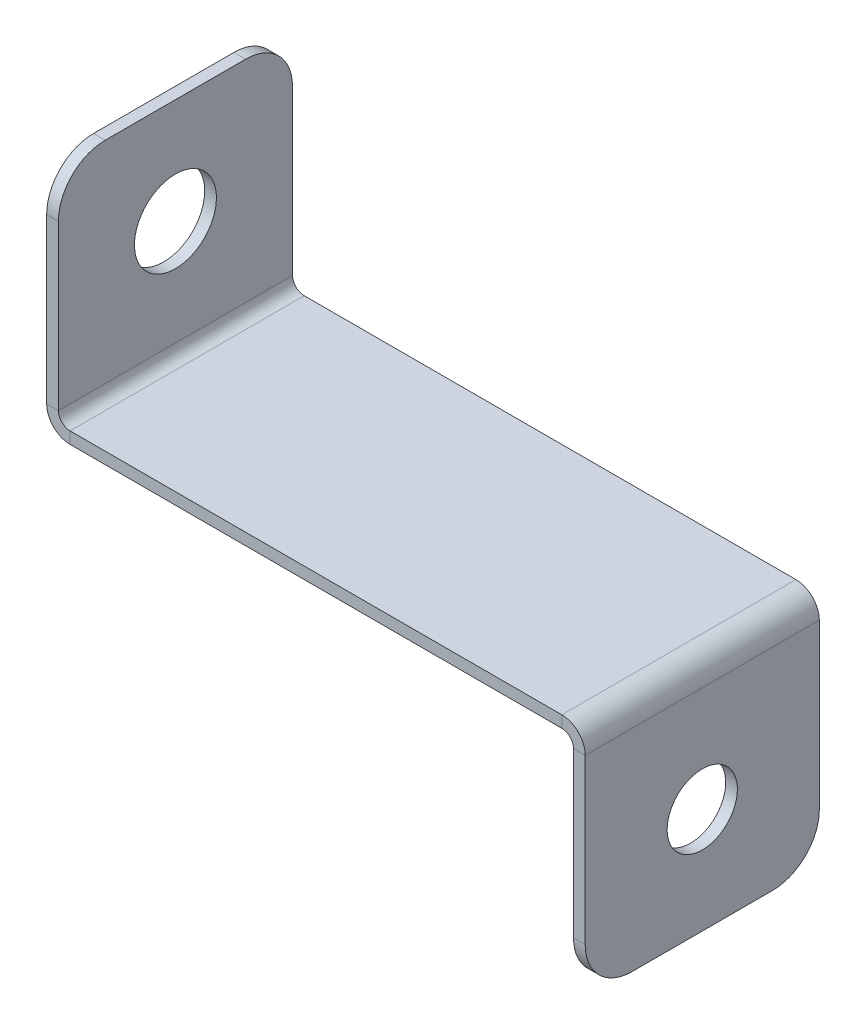
from build123d import *

# Parameters (mm, degrees)
SKETCH_1_W                       = 23
SKETCH_1_H                       = 10
EXTRUDE_1_DEPTH                  = 0.5
SM_EDGE_FLANGE_1_STRIP_W         = 3
SM_EDGE_FLANGE_1_STRIP_H         = 0.5
SM_EDGE_FLANGE_1_STRIP_CUT_DEPTH = 10
SM_EDGE_FLANGE_1_DEPTH           = 10
SM_EDGE_FLANGE_2_STRIP_W         = 3
SM_EDGE_FLANGE_2_STRIP_H         = 0.5
SM_EDGE_FLANGE_2_STRIP_CUT_DEPTH = 10
SM_EDGE_FLANGE_2_DEPTH           = 10
SKETCH_12_R                      = 1.5
CUT_EXTRUDE_1_DEPTH              = 0.5
SKETCH_13_R                      = 1.75
CUT_EXTRUDE_2_DEPTH              = 0.5
FILLET_1_R                       = 2


# Sheet-metal steps are written as plain solids
with BuildPart() as part:
    # Sketch 1 → Бобышка-Вытянуть1 (new body)
    with BuildSketch(Plane(origin=(0, 0, 0), x_dir=(1, 0, 0), z_dir=(0, 1, 0))):
        with Locations((-10.5, 0)):
            Rectangle(SKETCH_1_W, SKETCH_1_H)
    extrude(amount=EXTRUDE_1_DEPTH)

    # Ребро-кромка1 strip (across the edge) → Ребро-кромка1 strip cut (cut)
    with BuildSketch(Plane(origin=(1, 0, -5), x_dir=(-1, 0, 0), z_dir=(0, 0, 1))):
        with Locations((-0.5, -0.25)):
            Rectangle(SM_EDGE_FLANGE_1_STRIP_W, SM_EDGE_FLANGE_1_STRIP_H)
    extrude(amount=SM_EDGE_FLANGE_1_STRIP_CUT_DEPTH, mode=Mode.SUBTRACT)

    # Ребро-кромка1 section (across the edge) → Ребро-кромка1 (add)
    with BuildSketch(Plane(origin=(1, 0, -5), x_dir=(-1, 0, 0), z_dir=(0, 0, 1))):
        with BuildLine():
            Line((0, 0.5), (0, 9.5))
            Line((0, 9.5), (0.5, 9.5))
            Line((0.5, 9.5), (0.5, 0.5))
            ThreePointArc((0.5, 0.5), (0.646446609, 0.146446609), (1, 0))
            Line((1, 0), (1, -0.5))
            ThreePointArc((1, -0.5), (0.292893219, -0.207106781), (0, 0.5))
        make_face()
    extrude(amount=SM_EDGE_FLANGE_1_DEPTH)

    # Ребро-кромка2 strip (across the edge) → Ребро-кромка2 strip cut (cut)
    with BuildSketch(Plane(origin=(-22, 0.5, -5), x_dir=(1, 0, 0), z_dir=(0, 0, 1))):
        with Locations((-0.5, -0.25)):
            Rectangle(SM_EDGE_FLANGE_2_STRIP_W, SM_EDGE_FLANGE_2_STRIP_H)
    extrude(amount=SM_EDGE_FLANGE_2_STRIP_CUT_DEPTH, mode=Mode.SUBTRACT)

    # Ребро-кромка2 section (across the edge) → Ребро-кромка2 (add)
    with BuildSketch(Plane(origin=(-22, 0.5, -5), x_dir=(1, 0, 0), z_dir=(0, 0, 1))):
        with BuildLine():
            Line((0, 0.5), (0, 9.5))
            Line((0, 9.5), (0.5, 9.5))
            Line((0.5, 9.5), (0.5, 0.5))
            ThreePointArc((0.5, 0.5), (0.646446609, 0.146446609), (1, 0))
            Line((1, 0), (1, -0.5))
            ThreePointArc((1, -0.5), (0.292893219, -0.207106781), (0, 0.5))
        make_face()
    extrude(amount=SM_EDGE_FLANGE_2_DEPTH)

    # Эскиз12 → Вырез-Вытянуть1 (cut)
    with BuildSketch(Plane(origin=(1, 0, 0), x_dir=(0, 0, -1), z_dir=(1, 0, 0))):
        with Locations(Location((0, -5, 0), (0, 0, 90))):
            Circle(SKETCH_12_R)
    extrude(amount=-CUT_EXTRUDE_1_DEPTH, mode=Mode.SUBTRACT)

    # Эскиз13 → Вырез-Вытянуть2 (cut)
    with BuildSketch(Plane(origin=(-21.5, 0, 0), x_dir=(0, 0, -1), z_dir=(1, 0, 0))):
        with Locations(Location((0, 5.5, 0), (0, 0, 90))):
            Circle(SKETCH_13_R)
    extrude(amount=-CUT_EXTRUDE_2_DEPTH, mode=Mode.SUBTRACT)

    # Скругление1
    fillet_1_edges = [part.edges().sort_by_distance(p)[0] for p in [
        (0.75, -9.5, -5),
        (0.75, -9.5, 5),
        (-21.75, 10, -5),
        (-21.75, 10, 5),
    ]]
    fillet(fillet_1_edges, radius=FILLET_1_R)


solid = part.part
